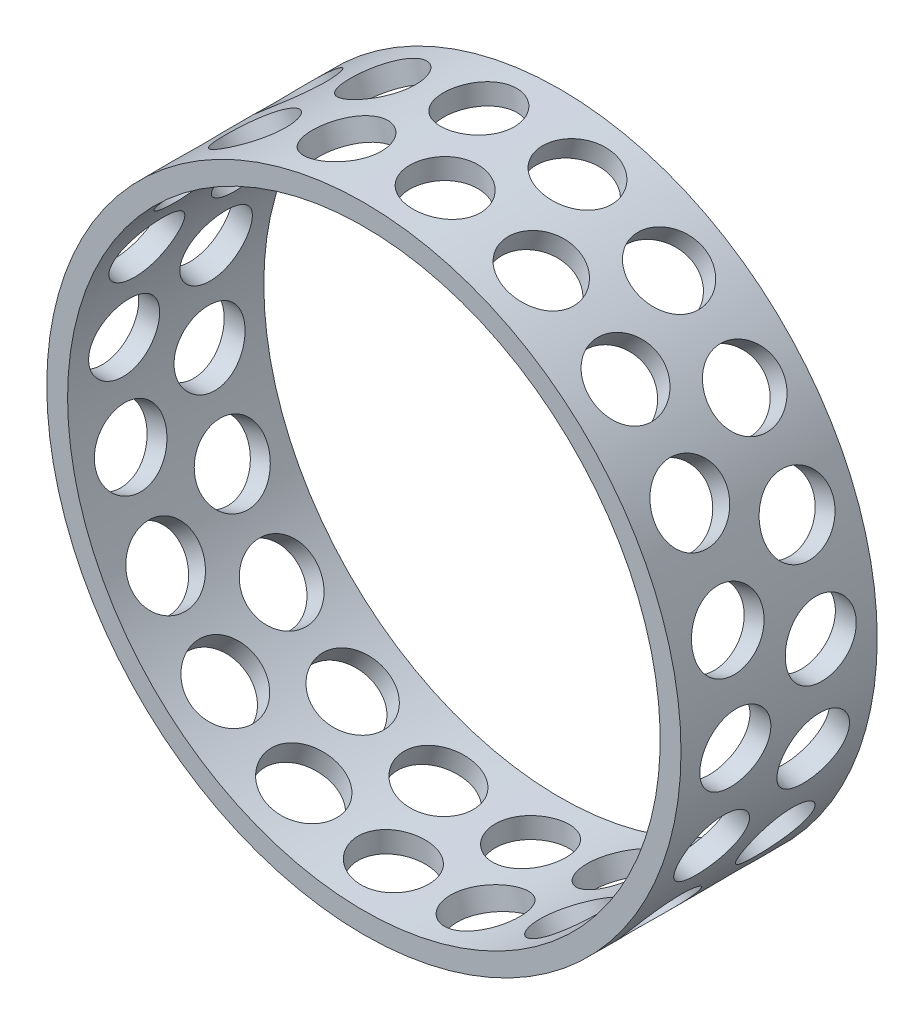
from build123d import *

# Parameters (mm, degrees)
SKETCH1_W          = 47.15
SKETCH1_H          = 5
SKETCH2_R          = 8.5
CUT_EXTRUDE1_DEPTH = 119.030938741
CIRPATTERN1_COUNT  = 20


with BuildPart() as part:
    # Sketch1 → Revolve1 (revolve)
    with BuildSketch(Plane(origin=(0, 0, 0), x_dir=(0, 0, -1), z_dir=(1, 0, 0))):
        with Locations((24.575, 73.7)):
            Rectangle(SKETCH1_W, SKETCH1_H)
    revolve(axis=Axis((0, 0, -50.5075), (0, 0, 1)))

    # Sketch2 → Cut-Extrude1 (cut, through all)
    with BuildSketch(Plane(origin=(0, 0, 0), x_dir=(0, 0, -1), z_dir=(1, 0, 0))):
        with Locations((14.309765987, 6.214899086)):
            Circle(SKETCH2_R)
        with Locations((34.840234013, -6.214899086)):
            Circle(SKETCH2_R)
    cut_extrude1 = extrude(amount=-CUT_EXTRUDE1_DEPTH, mode=Mode.SUBTRACT)

    # CirPattern1: Cut-Extrude1 ×20 about axis
    cirpattern1_axis = Axis((0, 0, -50.5075), (0, 0, 1))
    for i in range(1, CIRPATTERN1_COUNT):
        add(cut_extrude1.rotate(cirpattern1_axis, i * 360 / CIRPATTERN1_COUNT), mode=Mode.SUBTRACT)


solid = part.part
